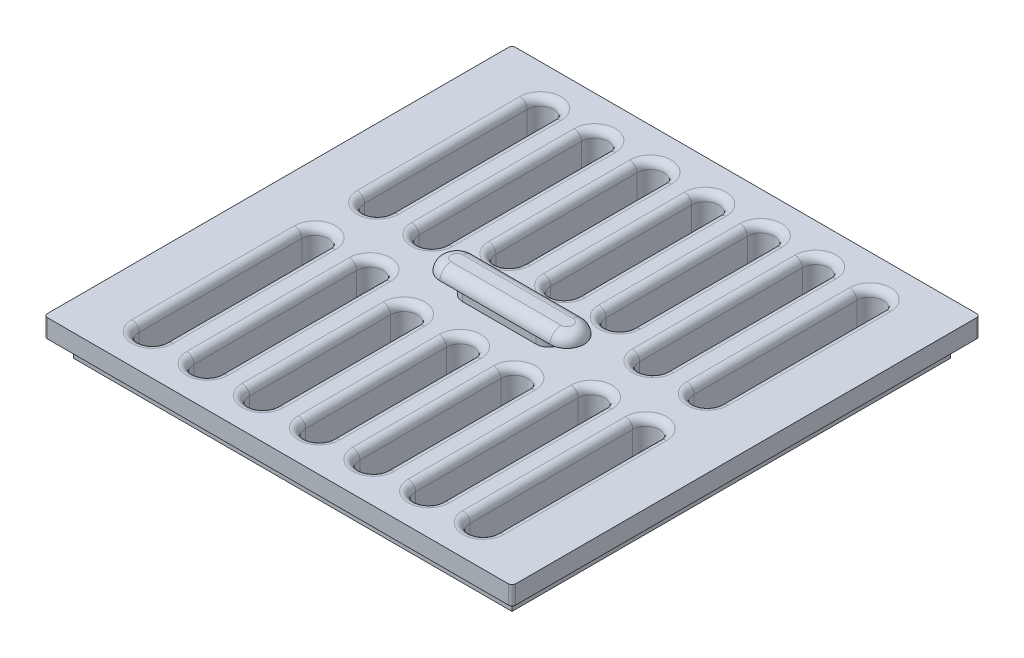
from build123d import *

# Parameters (mm, degrees)
SKETCH2_W           = 127
SKETCH2_H           = 127
BOSS_EXTRUDE1_DEPTH = 5
SKETCH3_W           = 119
SKETCH3_H           = 119
BOSS_EXTRUDE2_DEPTH = 5
FILLET1_R           = 1
BOSS_EXTRUDE3_DEPTH = 3
BOSS_EXTRUDE4_DEPTH = 3
FILLET2_R           = 3
CUT_EXTRUDE1_DEPTH  = 23
FILLET3_R           = 2


with BuildPart() as part:
    # Sketch2 → Boss-Extrude1 (new body)
    with BuildSketch(Plane(origin=(0, 0, 0), x_dir=(1, 0, 0), z_dir=(0, 1, 0))):
        with Locations((10.651612903, 18.333064516)):
            Rectangle(SKETCH2_W, SKETCH2_H)
    extrude(amount=BOSS_EXTRUDE1_DEPTH)

    # Sketch3 → Boss-Extrude2 (add)
    with BuildSketch(Plane.XZ):
        with Locations((10.651612903, -18.333064516)):
            Rectangle(SKETCH3_W, SKETCH3_H)
    extrude(amount=BOSS_EXTRUDE2_DEPTH)

    # Fillet1
    fillet1_edges = [part.edges().sort_by_distance(p)[0] for p in [
        (-52.848387097, 2.5, -81.833064516),
        (74.151612903, 2.5, -81.833064516),
        (74.151612903, 2.5, 45.166935484),
        (-52.848387097, 2.5, 45.166935484),
    ]]
    fillet(fillet1_edges, radius=FILLET1_R)

    # Sketch4 → Boss-Extrude3 (add)
    with BuildSketch(Plane(origin=(0, 5, 0), x_dir=(1, 0, 0), z_dir=(0, 1, 0))):
        with BuildLine():
            Line((0.651612903, 21.766921577), (20.651612903, 21.766921577))
            ThreePointArc((20.651612903, 21.766921577), (24.085469965, 18.333064516), (20.651612903, 14.899207455))
            Line((20.651612903, 14.899207455), (0.651612903, 14.899207455))
            ThreePointArc((0.651612903, 14.899207455), (-2.782244158, 18.333064516), (0.651612903, 21.766921577))
        make_face()
    extrude(amount=BOSS_EXTRUDE3_DEPTH)

    # Sketch5 → Boss-Extrude4 (add)
    with BuildSketch(Plane(origin=(0, 8, 0), x_dir=(1, 0, 0), z_dir=(0, 1, 0))):
        with BuildLine():
            Line((-4.282244158, 22.938856154), (25.585469965, 22.938856154))
            ThreePointArc((25.585469965, 22.938856154), (30.191261602, 18.333064516), (25.585469965, 13.727272878))
            Line((25.585469965, 13.727272878), (-4.282244158, 13.727272878))
            ThreePointArc((-4.282244158, 13.727272878), (-8.888035796, 18.333064516), (-4.282244158, 22.938856154))
        make_face()
    extrude(amount=BOSS_EXTRUDE4_DEPTH)

    # Fillet2
    fillet2_edges = [part.edges().sort_by_distance(p)[0] for p in [
        (-8.888035796, 11, -18.333064516),
        (10.651612903, 11, -22.938856154),
        (30.191261602, 11, -18.333064516),
        (10.651612903, 11, -13.727272878),
    ]]
    fillet(fillet2_edges, radius=FILLET2_R - 0.0001)  # a hair under: the kernel refuses the full size

    # Sketch6 → Cut-Extrude1 (cut)
    with BuildSketch(Plane(origin=(0, 5, 0), x_dir=(1, 0, 0), z_dir=(0, 1, 0))):
        with BuildLine():
            Line((-30.54759674, 70.834300294), (-30.54759674, 26.716652323))
            ThreePointArc((-30.54759674, 26.716652323), (-34.142244158, 23.122004906), (-37.736891576, 26.716652323))
            Line((-37.736891576, 26.716652323), (-37.736891576, 70.834300294))
            ThreePointArc((-37.736891576, 70.834300294), (-34.142244158, 74.428947712), (-30.54759674, 70.834300294))
        make_face()
        with BuildLine():
            Line((-15.668383644, 70.700231666), (-15.668383644, 26.582583695))
            ThreePointArc((-15.668383644, 26.582583695), (-19.263031062, 22.987936277), (-22.857678479, 26.582583695))
            Line((-22.857678479, 26.582583695), (-22.857678479, 70.700231666))
            ThreePointArc((-22.857678479, 70.700231666), (-19.263031062, 74.294879084), (-15.668383644, 70.700231666))
        make_face()
        with BuildLine():
            Line((43.986018434, 70.951447075), (43.986018434, 26.833799104))
            ThreePointArc((43.986018434, 26.833799104), (40.391371017, 23.239151686), (36.796723599, 26.833799104))
            Line((36.796723599, 26.833799104), (36.796723599, 70.951447075))
            ThreePointArc((36.796723599, 70.951447075), (40.391371017, 74.546094493), (43.986018434, 70.951447075))
        make_face()
        with BuildLine():
            Line((59.051076502, 70.659638364), (59.051076502, 26.541990393))
            ThreePointArc((59.051076502, 26.541990393), (55.456429084, 22.947342975), (51.861781666, 26.541990393))
            Line((51.861781666, 26.541990393), (51.861781666, 70.659638364))
            ThreePointArc((51.861781666, 70.659638364), (55.456429084, 74.254285782), (59.051076502, 70.659638364))
        make_face()
        with BuildLine():
            Line((-30.784999095, 9.927087611), (-30.784999095, -34.19056036))
            ThreePointArc((-30.784999095, -34.19056036), (-34.379646512, -37.785207778), (-37.97429393, -34.19056036))
            Line((-37.97429393, -34.19056036), (-37.97429393, 9.927087611))
            ThreePointArc((-37.97429393, 9.927087611), (-34.379646512, 13.521735029), (-30.784999095, 9.927087611))
        make_face()
        with BuildLine():
            Line((-15.856200447, 9.879746798), (-15.856200447, -34.237901173))
            ThreePointArc((-15.856200447, -34.237901173), (-19.450847865, -37.832548591), (-23.045495283, -34.237901173))
            Line((-23.045495283, -34.237901173), (-23.045495283, 9.879746798))
            ThreePointArc((-23.045495283, 9.879746798), (-19.450847865, 13.474394216), (-15.856200447, 9.879746798))
        make_face()
        with BuildLine():
            Line((44.148815025, 9.965576219), (44.148815025, -34.152071752))
            ThreePointArc((44.148815025, -34.152071752), (40.554167607, -37.74671917), (36.959520189, -34.152071752))
            Line((36.959520189, -34.152071752), (36.959520189, 9.965576219))
            ThreePointArc((36.959520189, 9.965576219), (40.554167607, 13.560223637), (44.148815025, 9.965576219))
        make_face()
        with BuildLine():
            Line((58.963304753, 9.965576219), (58.963304753, -34.152071752))
            ThreePointArc((58.963304753, -34.152071752), (55.368657335, -37.74671917), (51.774009917, -34.152071752))
            Line((51.774009917, -34.152071752), (51.774009917, 9.965576219))
            ThreePointArc((51.774009917, 9.965576219), (55.368657335, 13.560223637), (58.963304753, 9.965576219))
        make_face()
        with BuildLine():
            Line((-0.620247341, 70.834300294), (-0.620247341, 32.565590672))
            ThreePointArc((-0.620247341, 32.565590672), (-4.282244158, 28.903593855), (-7.944240975, 32.565590672))
            Line((-7.944240975, 32.565590672), (-7.944240975, 70.834300294))
            ThreePointArc((-7.944240975, 70.834300294), (-4.282244158, 74.496297111), (-0.620247341, 70.834300294))
        make_face()
        with BuildLine():
            Line((14.357038978, 70.712168219), (14.357038978, 32.443458596))
            ThreePointArc((14.357038978, 32.443458596), (10.695042161, 28.78146178), (7.033045344, 32.443458596))
            Line((7.033045344, 32.443458596), (7.033045344, 70.712168219))
            ThreePointArc((7.033045344, 70.712168219), (10.695042161, 74.374165036), (14.357038978, 70.712168219))
        make_face()
        with BuildLine():
            Line((29.252000533, 70.88437608), (29.252000533, 32.615666457))
            ThreePointArc((29.252000533, 32.615666457), (25.590003717, 28.953669641), (21.9280069, 32.615666457))
            Line((21.9280069, 32.615666457), (21.9280069, 70.88437608))
            ThreePointArc((21.9280069, 70.88437608), (25.590003717, 74.546372897), (29.252000533, 70.88437608))
        make_face()
        with BuildLine():
            Line((-0.702572104, 4.053367853), (-0.702572104, -34.215341769))
            ThreePointArc((-0.702572104, -34.215341769), (-4.364568921, -37.877338586), (-8.026565738, -34.215341769))
            Line((-8.026565738, -34.215341769), (-8.026565738, 4.053367853))
            ThreePointArc((-8.026565738, 4.053367853), (-4.364568921, 7.71536467), (-0.702572104, 4.053367853))
        make_face()
        with BuildLine():
            Line((14.50934326, 4.053367853), (14.50934326, -34.215341769))
            ThreePointArc((14.50934326, -34.215341769), (10.847346444, -37.877338586), (7.185349627, -34.215341769))
            Line((7.185349627, -34.215341769), (7.185349627, 4.053367853))
            ThreePointArc((7.185349627, 4.053367853), (10.847346444, 7.71536467), (14.50934326, 4.053367853))
        make_face()
        with BuildLine():
            Line((29.259184132, 4.053367853), (29.259184132, -34.215341769))
            ThreePointArc((29.259184132, -34.215341769), (25.597187315, -37.877338586), (21.935190498, -34.215341769))
            Line((21.935190498, -34.215341769), (21.935190498, 4.053367853))
            ThreePointArc((21.935190498, 4.053367853), (25.597187315, 7.71536467), (29.259184132, 4.053367853))
        make_face()
    extrude(amount=-CUT_EXTRUDE1_DEPTH, mode=Mode.SUBTRACT)

    # Fillet3
    fillet3_edges = [part.edges().sort_by_distance(p)[0] for p in [
        (-19.450847865, 5, -13.474394216),
        (-23.045495283, 5, 12.179077188),
        (-19.450847865, 5, 37.832548591),
        (-15.856200447, 5, 12.179077188),
        (40.554167607, 5, -13.560223637),
        (36.959520189, 5, 12.093247766),
        (40.554167607, 5, 37.74671917),
        (44.148815025, 5, 12.093247766),
        (55.368657335, 5, -13.560223637),
        (51.774009917, 5, 12.093247766),
        (55.368657335, 5, 37.74671917),
        (58.963304753, 5, 12.093247766),
        (-4.282244158, 5, -74.496297111),
        (-7.944240975, 5, -51.699945483),
        (-4.282244158, 5, -28.903593855),
        (-0.620247341, 5, -51.699945483),
        (-19.263031062, 5, -74.294879084),
        (-22.857678479, 5, -48.641407681),
        (-19.263031062, 5, -22.987936277),
        (-15.668383644, 5, -48.641407681),
        (40.391371017, 5, -74.546094493),
        (36.796723599, 5, -48.89262309),
        (40.391371017, 5, -23.239151686),
        (43.986018434, 5, -48.89262309),
        (55.456429084, 5, -74.254285782),
        (51.861781666, 5, -48.600814378),
        (55.456429084, 5, -22.947342975),
        (59.051076502, 5, -48.600814378),
        (-34.379646512, 5, -13.521735029),
        (-37.97429393, 5, 12.131736374),
        (-34.379646512, 5, 37.785207778),
        (-30.784999095, 5, 12.131736374),
        (25.597187315, 5, -7.71536467),
        (21.935190498, 5, 15.080986958),
        (25.597187315, 5, 37.877338586),
        (29.259184132, 5, 15.080986958),
        (10.847346444, 5, -7.71536467),
        (7.185349627, 5, 15.080986958),
        (10.847346444, 5, 37.877338586),
        (14.50934326, 5, 15.080986958),
        (-4.364568921, 5, -7.71536467),
        (-8.026565738, 5, 15.080986958),
        (-4.364568921, 5, 37.877338586),
        (-0.702572104, 5, 15.080986958),
        (25.590003717, 5, -74.546372897),
        (21.9280069, 5, -51.750021269),
        (25.590003717, 5, -28.953669641),
        (29.252000533, 5, -51.750021269),
        (10.695042161, 5, -74.374165036),
        (7.033045344, 5, -51.577813408),
        (10.695042161, 5, -28.78146178),
        (14.357038978, 5, -51.577813408),
        (-34.142244158, 5, -74.428947712),
        (-37.736891576, 5, -48.775476309),
        (-34.142244158, 5, -23.122004906),
        (-30.54759674, 5, -48.775476309),
    ]]
    fillet(fillet3_edges, radius=FILLET3_R)


solid = part.part
